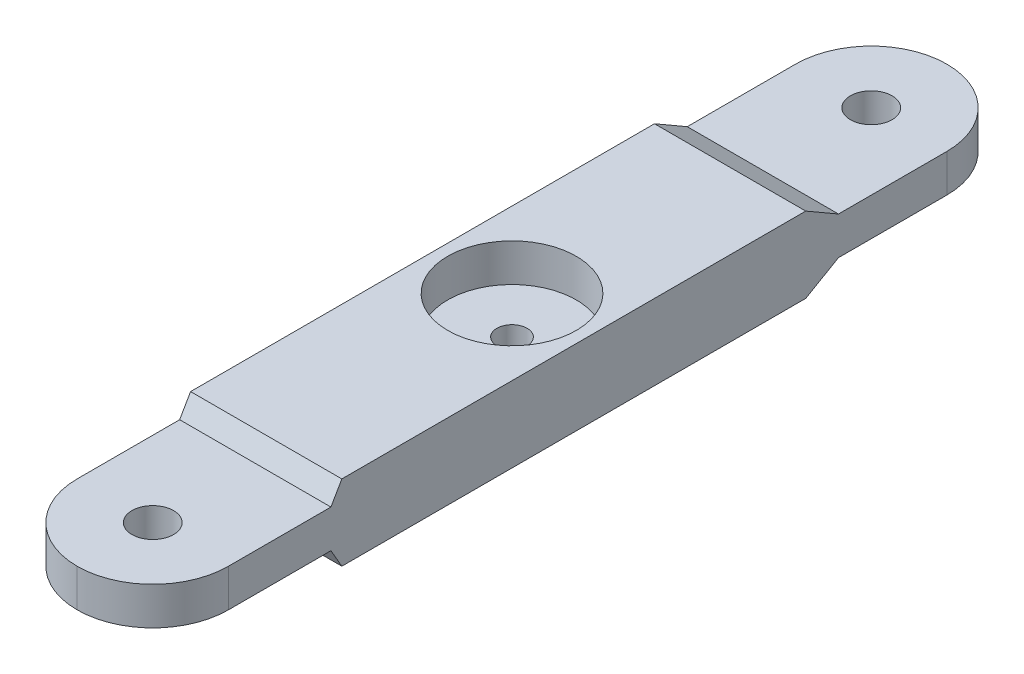
from build123d import *

# Parameters (mm, degrees)
BOSS_EXTRUDE1_DEPTH      = 37.5
BOSS_EXTRUDE1_DEPTH_BACK = 37.5
SKETCH1_W                = 20
SKETCH1_H                = 10
SKETCH3_W                = 20
SKETCH3_H                = 5
BOSS_EXTRUDE2_DEPTH      = 20
FILLET1_R                = 10
SKETCH4_R                = 2.75
CUT_EXTRUDE1_DEPTH       = 59.84301148
FILLET1_OF_MIRROR3_R     = 10
CHAMFER1_SIZE            = 8.660254038
CHAMFER1_SIZE_2          = 5
SKETCH6_R                = 8.5
CUT_EXTRUDE2_DEPTH       = 5
CUT_EXTRUDE3_DEPTH       = 59.576872569
CUT_EXTRUDE3_DEPTH_BACK  = 59.576872569
SKETCH7_R                = 2


# Some blends are built 0.0001 mm under size
with BuildPart() as part:
    # Sketch1 → Boss-Extrude1 (new, two sides: drawn at the far end of the back side and taken through both)
    with BuildSketch(Plane.XY.offset(-BOSS_EXTRUDE1_DEPTH_BACK)):
        Rectangle(SKETCH1_W, SKETCH1_H)
    extrude(amount=BOSS_EXTRUDE1_DEPTH + BOSS_EXTRUDE1_DEPTH_BACK)

    # Sketch3 → Boss-Extrude2 (add)
    with BuildSketch(Plane(origin=(0, 0, -37.5), x_dir=(-1, 0, 0), z_dir=(0, 0, -1))):
        Rectangle(SKETCH3_W, SKETCH3_H)
    boss_extrude2 = extrude(amount=BOSS_EXTRUDE2_DEPTH)

    # Fillet1
    fillet1_edges = [part.edges().sort_by_distance(p)[0] for p in [
        (-10, 0, -57.5),
        (10, 0, -57.5),
    ]]
    fillet(fillet1_edges, radius=FILLET1_R - 0.0001)  # a hair under: the kernel refuses the full size

    # Sketch4 → Cut-Extrude1 (cut, through all)
    with BuildSketch(Plane(origin=(0, 2.5, 0), x_dir=(1, 0, 0), z_dir=(0, 1, 0))):
        with Locations(Location((0, 47.5, 0), (0, 0, 270))):
            Circle(SKETCH4_R)
    cut_extrude1 = extrude(amount=-CUT_EXTRUDE1_DEPTH, mode=Mode.SUBTRACT)

    # Mirror3: Boss-Extrude2, Cut-Extrude1 across plane
    add(boss_extrude2.mirror(Plane.XY))
    add(cut_extrude1.mirror(Plane.XY), mode=Mode.SUBTRACT)

    # Fillet1 of Mirror3
    fillet1_of_mirror3_edges = [part.edges().sort_by_distance(p)[0] for p in [
        (-10, 0, 57.5),
        (10, 0, 57.5),
    ]]
    fillet(fillet1_of_mirror3_edges, radius=FILLET1_OF_MIRROR3_R - 0.0001)  # a hair under: the kernel refuses the full size

    # Chamfer1
    # the kernel refuses this chamfer: 8.660254038, 5 mm, written as the material it takes off along each edge
    with BuildSketch(Plane(origin=(32.404819853, 5, -37.5), x_dir=(0, 0.019326765612700598, 0.9998132206222078), z_dir=(-1, 0, 0))) as chamfer1_piece_1_section:
        Polygon((CHAMFER1_SIZE * 0.999813220604, -CHAMFER1_SIZE * 0.0193267656124), (-CHAMFER1_SIZE_2 * 0.0193267656127, -CHAMFER1_SIZE_2 * 0.999813220622), (0, 0), align=None)
    chamfer1_piece_1 = extrude(amount=64.809639706, mode=Mode.PRIVATE)
    chamfer1_piece_1 = split(chamfer1_piece_1, bisect_by=Plane(origin=(0, 2.5, -34.039331058), z_dir=(0, 1, 0)), keep=Keep.TOP, mode=Mode.PRIVATE)
    add(chamfer1_piece_1, mode=Mode.SUBTRACT)
    with BuildSketch(Plane(origin=(-32.404819853, -5, -37.5), x_dir=(0, -0.019326765612700598, 0.9998132206222078), z_dir=(1, 0, 0))) as chamfer1_piece_2_section:
        Polygon((CHAMFER1_SIZE * 0.999813220604, -CHAMFER1_SIZE * 0.0193267656124), (-CHAMFER1_SIZE_2 * 0.0193267656127, -CHAMFER1_SIZE_2 * 0.999813220622), (0, 0), align=None)
    chamfer1_piece_2 = extrude(amount=64.809639706, mode=Mode.PRIVATE)
    chamfer1_piece_2 = split(chamfer1_piece_2, bisect_by=Plane(origin=(0, -2.5, -34.039331058), z_dir=(0, -1, 0)), keep=Keep.TOP, mode=Mode.PRIVATE)
    add(chamfer1_piece_2, mode=Mode.SUBTRACT)
    with BuildSketch(Plane(origin=(-32.404819853, -5, 37.5), x_dir=(0, 0.999813220622208, 0.019326765612700494), z_dir=(1, 0, 0))) as chamfer1_piece_3_section:
        Polygon((CHAMFER1_SIZE * 0.999813220604, -CHAMFER1_SIZE * 0.0193267656124), (-CHAMFER1_SIZE_2 * 0.0193267656127, -CHAMFER1_SIZE_2 * 0.999813220622), (0, 0), align=None)
    chamfer1_piece_3 = extrude(amount=64.809639706, mode=Mode.PRIVATE)
    chamfer1_piece_3 = split(chamfer1_piece_3, bisect_by=Plane(origin=(0, 2.5, 37.476500167), z_dir=(0, 1, 0)), keep=Keep.TOP, mode=Mode.PRIVATE)
    add(chamfer1_piece_3, mode=Mode.SUBTRACT)
    with BuildSketch(Plane(origin=(-32.404819853, -5, 37.5), x_dir=(0, 0.999813220622208, 0.019326765612700494), z_dir=(1, 0, 0))) as chamfer1_piece_4_section:
        Polygon((CHAMFER1_SIZE * 0.999813220604, -CHAMFER1_SIZE * 0.0193267656124), (-CHAMFER1_SIZE_2 * 0.0193267656127, -CHAMFER1_SIZE_2 * 0.999813220622), (0, 0), align=None)
    chamfer1_piece_4 = extrude(amount=64.809639706, mode=Mode.PRIVATE)
    chamfer1_piece_4 = split(chamfer1_piece_4, bisect_by=Plane(origin=(0, -2.5, 35.327003025), z_dir=(0, -1, 0)), keep=Keep.TOP, mode=Mode.PRIVATE)
    add(chamfer1_piece_4, mode=Mode.SUBTRACT)
    with BuildSketch(Plane(origin=(32.404819853, 5, 37.5), x_dir=(0, -0.999813220622208, 0.019326765612700494), z_dir=(-1, 0, 0))) as chamfer1_piece_5_section:
        Polygon((CHAMFER1_SIZE * 0.999813220604, -CHAMFER1_SIZE * 0.0193267656124), (-CHAMFER1_SIZE_2 * 0.0193267656127, -CHAMFER1_SIZE_2 * 0.999813220622), (0, 0), align=None)
    chamfer1_piece_5 = extrude(amount=64.809639706, mode=Mode.PRIVATE)
    chamfer1_piece_5 = split(chamfer1_piece_5, bisect_by=Plane(origin=(0, -2.5, 37.476500167), z_dir=(0, -1, 0)), keep=Keep.TOP, mode=Mode.PRIVATE)
    add(chamfer1_piece_5, mode=Mode.SUBTRACT)
    with BuildSketch(Plane(origin=(32.404819853, 5, 37.5), x_dir=(0, -0.999813220622208, 0.019326765612700494), z_dir=(-1, 0, 0))) as chamfer1_piece_6_section:
        Polygon((CHAMFER1_SIZE * 0.999813220604, -CHAMFER1_SIZE * 0.0193267656124), (-CHAMFER1_SIZE_2 * 0.0193267656127, -CHAMFER1_SIZE_2 * 0.999813220622), (0, 0), align=None)
    chamfer1_piece_6 = extrude(amount=64.809639706, mode=Mode.PRIVATE)
    chamfer1_piece_6 = split(chamfer1_piece_6, bisect_by=Plane(origin=(0, 2.5, 35.327003025), z_dir=(0, 1, 0)), keep=Keep.TOP, mode=Mode.PRIVATE)
    add(chamfer1_piece_6, mode=Mode.SUBTRACT)

    # Sketch6 → Cut-Extrude2 (cut)
    with BuildSketch(Plane(origin=(0, 5, 0), x_dir=(1, 0, 0), z_dir=(0, 1, 0))):
        with Locations(Location((0, 0, 0), (0, 0, 270))):
            Circle(SKETCH6_R)
    extrude(amount=-CUT_EXTRUDE2_DEPTH, mode=Mode.SUBTRACT)

    # Sketch7 → Cut-Extrude3 (cut, two sides: drawn at the far end of the back side and taken through both)
    with BuildSketch(Plane(origin=(0, 0, 0), x_dir=(1, 0, 0), z_dir=(0, 1, 0)).offset(-CUT_EXTRUDE3_DEPTH_BACK)):
        with Locations(Location((0, 0, 0), (0, 0, 270))):
            Circle(SKETCH7_R)
    extrude(amount=CUT_EXTRUDE3_DEPTH + CUT_EXTRUDE3_DEPTH_BACK, mode=Mode.SUBTRACT)


solid = part.part
